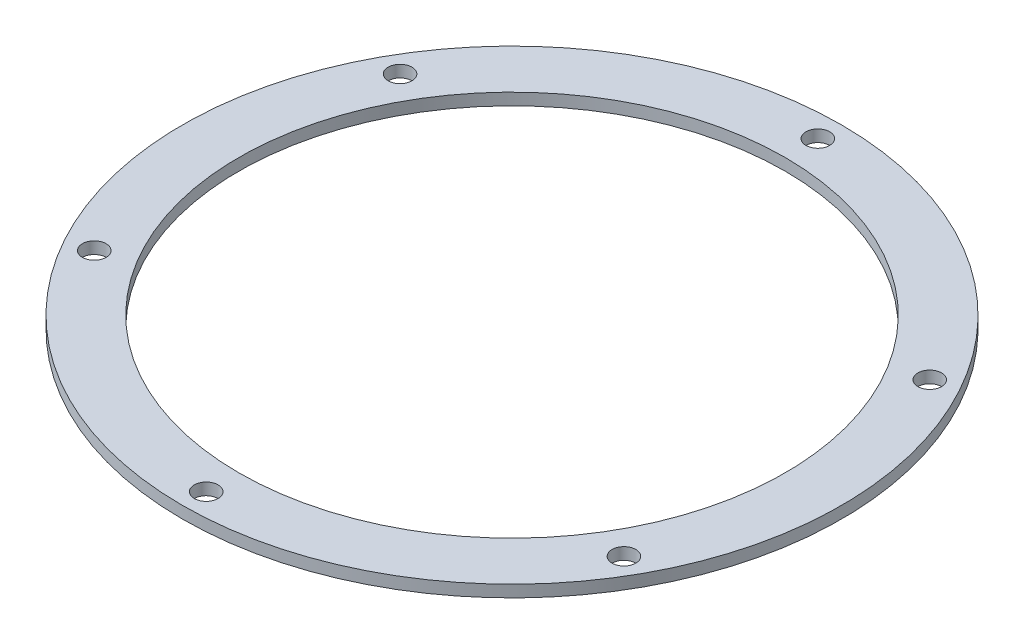
from build123d import *

# Parameters (mm, degrees)
SKETCH1_R           = 55.5
SKETCH1_R_2         = 46
SKETCH1_R_3         = 2
BOSS_EXTRUDE1_DEPTH = 2


with BuildPart() as part:
    # Sketch1 → Boss-Extrude1 (new body)
    with BuildSketch(Plane(origin=(0, 0, 0), x_dir=(1, 0, 0), z_dir=(0, 1, 0))):
        Circle(SKETCH1_R)
        Circle(SKETCH1_R_2, mode=Mode.SUBTRACT)
        with Locations((0, 51.5)):
            Circle(SKETCH1_R_3, mode=Mode.SUBTRACT)
        with Locations((44.600308295, 25.75)):
            Circle(SKETCH1_R_3, mode=Mode.SUBTRACT)
        with Locations((44.600308295, -25.75)):
            Circle(SKETCH1_R_3, mode=Mode.SUBTRACT)
        with Locations((0, -51.5)):
            Circle(SKETCH1_R_3, mode=Mode.SUBTRACT)
        with Locations((-44.600308295, -25.75)):
            Circle(SKETCH1_R_3, mode=Mode.SUBTRACT)
        with Locations((-44.600308295, 25.75)):
            Circle(SKETCH1_R_3, mode=Mode.SUBTRACT)
    extrude(amount=BOSS_EXTRUDE1_DEPTH)


solid = part.part
